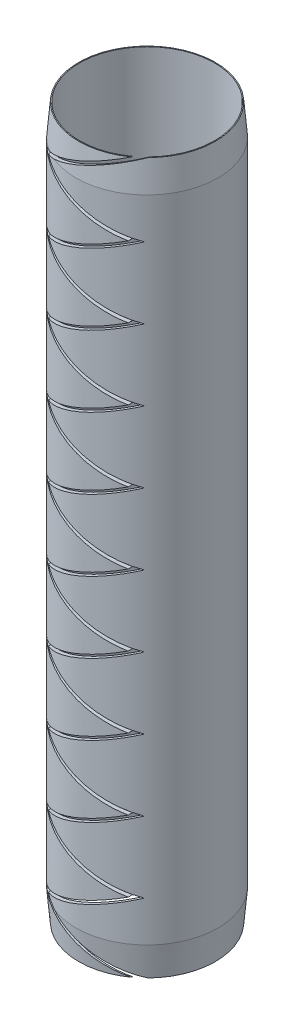
from build123d import *
from OCP.BRepFilletAPI import BRepFilletAPI_MakeChamfer

# Parameters (mm, degrees)
SKETCH1_R                                = 1.016
SHAFT_DEPTH                              = 5.08
SHELL_T                                  = -0.0508
TIP_CHAMFER_SIZE                         = 0.0381
TIP_CHAMFER_SIZE2                        = 0.435484993
ZIG_ZAG_CUT_DEPTH                        = 3.349527223
LINEAR_PATTERN_FOR_ZIG_ZAG_CUT_COUNT     = 6
LINEAR_PATTERN_FOR_ZIG_ZAG_CUT_PITCH     = 1.016
LINEAR_PATTERN_FOR_ZIG_ZAG_CUT_COL_COUNT = 6
LINEAR_PATTERN_FOR_ZIG_ZAG_CUT_COL_PITCH = 1.016


with BuildPart() as part:
    # Sketch1 → Shaft (new, symmetric)
    with BuildSketch(Plane(origin=(0, 0, 0), x_dir=(1, 0, 0), z_dir=(0, 1, 0))):
        Circle(SKETCH1_R)
    extrude(amount=SHAFT_DEPTH, both=True)

    # Shell
    shell_openings = [part.faces().sort_by_distance(p)[0] for p in [
        (0, -5.08, 0),
        (0, 5.08, 0),
    ]]
    offset(amount=SHELL_T, openings=shell_openings, kind=Kind.INTERSECTION)

    # Tip chamfer: one chamfer whose edges measure the first distance from different faces: ONE call of the kernel's chamfer builder (chamfer() names one face for all edges)
    tip_chamfer_edges_1 = [part.edges().sort_by_distance(p)[0] for p in [
        (-1.016, 5.08, 0),
    ]]
    tip_chamfer_side_1 = [part.faces().sort_by_distance(p)[0] for p in [
        (-0.98726318, 5.08, 0),
    ]]
    tip_chamfer_edges_2 = [part.edges().sort_by_distance(p)[0] for p in [
        (-1.016, -5.08, 0),
    ]]
    tip_chamfer_side_2 = [part.faces().sort_by_distance(p)[0] for p in [
        (-0.98726318, -5.08, 0),
    ]]
    tip_chamfer = BRepFilletAPI_MakeChamfer(part.part.solid().wrapped)
    for e in tip_chamfer_edges_1:
        tip_chamfer.Add(TIP_CHAMFER_SIZE, TIP_CHAMFER_SIZE2, e.wrapped, tip_chamfer_side_1[0].wrapped)  # the first distance lies on this face
    for e in tip_chamfer_edges_2:
        tip_chamfer.Add(TIP_CHAMFER_SIZE, TIP_CHAMFER_SIZE2, e.wrapped, tip_chamfer_side_2[0].wrapped)  # the first distance lies on this face
    add(Compound.cast(tip_chamfer.Shape()), mode=Mode.REPLACE)

    # Sketch2 → Zig zag cut (cut)
    with BuildSketch(Plane.XY):
        Polygon((-0.635, -0.4826), (0.5715, 0), (-0.635, 0.4826), (-0.6985, 0.508), (-0.635, 0.5334), (0.635, 0.0254), (0.6985, 0), (0.635, -0.0254), (-0.635, -0.5334), (-0.6985, -0.508), align=None)
    zig_zag_cut = extrude(amount=ZIG_ZAG_CUT_DEPTH, mode=Mode.SUBTRACT)

    # Linear pattern for zig zag cut: Zig zag cut ×6
    with Locations(*[(0, -i * LINEAR_PATTERN_FOR_ZIG_ZAG_CUT_PITCH, 0) for i in range(1, LINEAR_PATTERN_FOR_ZIG_ZAG_CUT_COUNT)]):
        add(zig_zag_cut, mode=Mode.SUBTRACT)

    # Linear pattern for zig zag cut col: Zig zag cut ×6
    with Locations(*[(0, i * LINEAR_PATTERN_FOR_ZIG_ZAG_CUT_COL_PITCH, 0) for i in range(1, LINEAR_PATTERN_FOR_ZIG_ZAG_CUT_COL_COUNT)]):
        add(zig_zag_cut, mode=Mode.SUBTRACT)


solid = part.part
